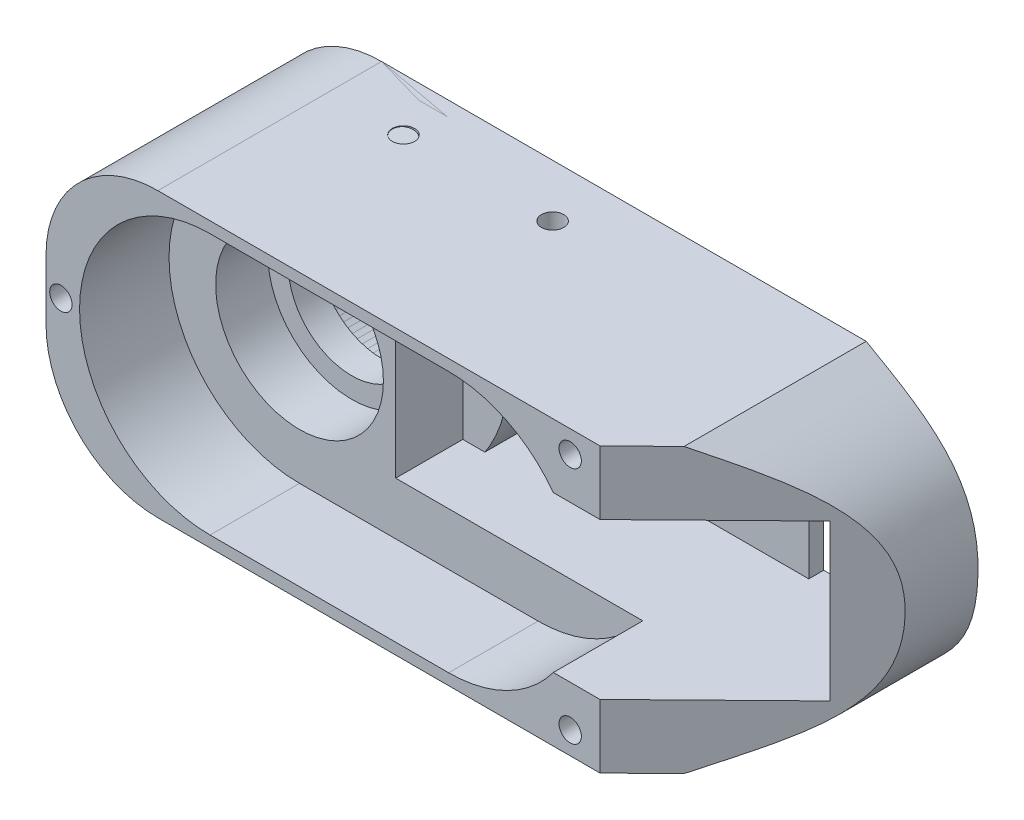
from build123d import *

# Parameters (mm, degrees)
NECKROT_3_0_3_DIAMETER_HOLE1_OUTLINE_W   = 55
NECKROT_3_0_3_DIAMETER_HOLE1_OUTLINE_H   = 20.891455382
NECKROT_3_0_3_DIAMETER_HOLE1_OUTLINE_R   = 11.25
NECKROT_3_0_3_DIAMETER_HOLE1_DEPTH       = 5.559887919
NECKROT_3_0_START                        = 8.559888019
NECKROT_3_0_3_DIAMETER_HOLE1_2_OUTLI_R   = 11.25
NECKROT_3_0_3_DIAMETER_HOLE1_2_DEPTH     = 9.440111981
NECKROT_3_0_3_DIAMETER_HOLE1_3_OUTLI_R   = 11.25
NECKROT_3_0_3_DIAMETER_HOLE1_3_OUTLI_R_2 = 8.5
NECKROT_3_0_3_DIAMETER_HOLE1_3_DEPTH     = 1.440111981
NECKROT_3_0_3_DIAMETER_HOLE1_4_OUTLI_W   = 7.3
NECKROT_3_0_3_DIAMETER_HOLE1_4_OUTLI_H   = 20.891455382
NECKROT_3_0_3_DIAMETER_HOLE1_4_OUTLI_R   = 2.25
NECKROT_3_0_3_DIAMETER_HOLE1_4_OUTLI_W_2 = 6.7
NECKROT_3_0_3_DIAMETER_HOLE1_4_DEPTH     = 2
NECKROT_3_0_START_2                      = 7
NECKROT_3_0_3_DIAMETER_HOLE1_5_OUTLI_R   = 11.25
NECKROT_3_0_3_DIAMETER_HOLE1_5_OUTLI_R_2 = 8.5
NECKROT_3_0_3_DIAMETER_HOLE1_5_DEPTH     = 4
NECKROT_3_0_START_3                      = 2
NECKROT_3_0_3_DIAMETER_HOLE1_6_OUTLI_R   = 1.5
NECKROT_3_0_3_DIAMETER_HOLE1_6_DEPTH     = 7.771146533
NECKROT_3_0_START_4                      = 5.559887919
NECKROT_3_0_3_DIAMETER_HOLE1_7_OUTLI_R   = 1.5
NECKROT_3_0_3_DIAMETER_HOLE1_7_DEPTH     = 24.440112081
NECKROT_3_0_3_DIAMETER_HOLE1_8_OUTLI_R   = 11.25
NECKROT_3_0_3_DIAMETER_HOLE1_8_DEPTH     = 3.0000001
NECKROT_3_0_START_5                      = -20
NECKROT_3_0_3_DIAMETER_HOLE1_9_DEPTH     = 40
NECKROT_3_0_3_DIAMETER_HOLE1_10_OUTL_R   = 1.5
NECKROT_3_0_3_DIAMETER_HOLE1_10_DEPTH    = 7
NECKROT_3_0_START_6                      = 13
NECKROT_3_0_3_DIAMETER_HOLE1_11_OUTL_R   = 1.5
NECKROT_3_0_3_DIAMETER_HOLE1_11_DEPTH    = 7
EXTRUDE1_DEPTH                           = 2
SKETCH4_R                                = 19
EXTRUDE4_DEPTH                           = 9
SKETCH3_R                                = 4
EXTRUDE3_DEPTH                           = 62.326992587
EXTRUDE5_START                           = -7
SKETCH5_R                                = 11.25
EXTRUDE5_DEPTH                           = 7
SKETCH6_W                                = 1.5
SKETCH6_H                                = 20
F_3_0_3_DIAMETER_HOLE1_AT_2_COUNT        = 2
F_3_0_3_DIAMETER_HOLE1_AT_2_PITCH        = 32
EXTRUDE6_START                           = -10
SKETCH7_R                                = 1.5
EXTRUDE6_DEPTH                           = 10
SKETCH8_R                                = 3.5
EXTRUDE7_DEPTH                           = 7


with BuildPart() as part:
    # <neckrot>-<Ø3.0 (3) Diameter Hole1>: read off the stored shape, not the designer's step
    # <neckrot>-<Ø3.0 (3) Diameter Hole1> outline → <neckrot>-<Ø3.0 (3) Diameter Hole1> (new body)
    with BuildSketch(Plane.XY):
        with BuildLine():
            Line((-35, -19), (30, -19))
            add(Edge.make_bspline(
                [(30, -19), (37.933016475, -14.419870803), (44.967612, -11.088320981), (45.16011468, 10.828695002), (36.561245044, 15.211863407), (30, 19)],
                knots=[0, 0, 0, 0, 0.45437066, 0.55437066, 1, 1, 1, 1], degree=3))
            Line((30, 19), (-35, 19))
            ThreePointArc((-35, 19), (-45.606601718, 14.606601718), (-50, 4))
            Line((-50, 4), (-50, -4))
            ThreePointArc((-50, -4), (-45.606601718, -14.606601718), (-35, -19))
        make_face()
        with Locations((12.4, 0)):
            Rectangle(NECKROT_3_0_3_DIAMETER_HOLE1_OUTLINE_W, NECKROT_3_0_3_DIAMETER_HOLE1_OUTLINE_H, mode=Mode.SUBTRACT)
        with Locations((-28, 0)):
            Circle(NECKROT_3_0_3_DIAMETER_HOLE1_OUTLINE_R, mode=Mode.SUBTRACT)
    extrude(amount=NECKROT_3_0_3_DIAMETER_HOLE1_DEPTH)

    # neckrot_-_3.0 _3_ Diameter Hole1 4 outli → neckrot_-_3.0 _3_ Diameter Hole1 4 (add)
    # profile 1 of 2: a face of its own
    with BuildSketch(Plane.XY):
        with Locations((-11.45, 0)):
            Rectangle(NECKROT_3_0_3_DIAMETER_HOLE1_4_OUTLI_W, NECKROT_3_0_3_DIAMETER_HOLE1_4_OUTLI_H)
        with Locations((-11.246799455, -4.995727691)):
            Circle(NECKROT_3_0_3_DIAMETER_HOLE1_4_OUTLI_R, mode=Mode.SUBTRACT)
        with Locations((-11.246799455, 5.004272309)):
            Circle(NECKROT_3_0_3_DIAMETER_HOLE1_4_OUTLI_R, mode=Mode.SUBTRACT)
    # profile 2 of 2: a face of its own
    with BuildSketch(Plane.XY):
        with Locations((36.55, 0)):
            Rectangle(NECKROT_3_0_3_DIAMETER_HOLE1_4_OUTLI_W_2, NECKROT_3_0_3_DIAMETER_HOLE1_4_OUTLI_H)
        with Locations((36.013200545, -4.995727691)):
            Circle(NECKROT_3_0_3_DIAMETER_HOLE1_4_OUTLI_R, mode=Mode.SUBTRACT)
        with Locations((36.013200545, 5.004272309)):
            Circle(NECKROT_3_0_3_DIAMETER_HOLE1_4_OUTLI_R, mode=Mode.SUBTRACT)
    extrude(amount=NECKROT_3_0_3_DIAMETER_HOLE1_4_DEPTH)



with BuildPart() as body_2:
    # neckrot_-_3.0 _3_ Diameter Hole1 2 outli → neckrot_-_3.0 _3_ Diameter Hole1 2 (new body)
    with BuildSketch(Plane.XY.offset(NECKROT_3_0_START)):
        with BuildLine():
            Line((-15.1, 10.445727691), (18.040540339, 10.445727691))
            ThreePointArc((18.040540339, 10.445727691), (11.856518485, 15.637298913), (4, 17.5))
            Line((4, 17.5), (-28, 17.5))
            ThreePointArc((-28, 17.5), (-45.5, 0), (-28, -17.5))
            Line((-28, -17.5), (4, -17.5))
            ThreePointArc((4, -17.5), (11.856518485, -15.637298913), (18.040540339, -10.445727691))
            Line((18.040540339, -10.445727691), (-15.1, -10.445727691))
            Line((-15.1, -10.445727691), (-15.1, 10.445727691))
        make_face()
        with Locations((-28, 0)):
            Circle(NECKROT_3_0_3_DIAMETER_HOLE1_2_OUTLI_R, mode=Mode.SUBTRACT)
    extrude(amount=NECKROT_3_0_3_DIAMETER_HOLE1_2_DEPTH)

    # neckrot_-_3.0 _3_ Diameter Hole1 3 outli → neckrot_-_3.0 _3_ Diameter Hole1 3 (add)
    # profile 1 of 2: a face of its own
    with BuildSketch(Plane.XY.offset(NECKROT_3_0_START)):
        with BuildLine():
            Line((-35, -19), (30, -19))
            add(Edge.make_bspline(
                [(30, -19), (37.933016475, -14.419870803), (44.967612, -11.088320981), (45.16011468, 10.828695002), (36.561245044, 15.211863407), (30, 19)],
                knots=[0, 0, 0, 0, 0.45437066, 0.55437066, 1, 1, 1, 1], degree=3))
            Line((30, 19), (-35, 19))
            ThreePointArc((-35, 19), (-45.606601718, 14.606601718), (-50, 4))
            Line((-50, 4), (-50, -4))
            ThreePointArc((-50, -4), (-45.606601718, -14.606601718), (-35, -19))
        make_face()
        with BuildLine():
            ThreePointArc((4, 17.5), (11.856518485, 15.637298913), (18.040540339, 10.445727691))
            Line((18.040540339, 10.445727691), (39.9, 10.445727691))
            Line((39.9, 10.445727691), (39.9, -10.445727691))
            Line((39.9, -10.445727691), (18.040540339, -10.445727691))
            ThreePointArc((18.040540339, -10.445727691), (11.856518485, -15.637298913), (4, -17.5))
            Line((4, -17.5), (-28, -17.5))
            ThreePointArc((-28, -17.5), (-45.5, 0), (-28, 17.5))
            Line((-28, 17.5), (4, 17.5))
        make_face(mode=Mode.SUBTRACT)
    # profile 2 of 2: a face of its own
    with BuildSketch(Plane.XY.offset(NECKROT_3_0_START)):
        with Locations((-28, 0)):
            Circle(NECKROT_3_0_3_DIAMETER_HOLE1_3_OUTLI_R)
        with Locations((-28, 0)):
            Circle(NECKROT_3_0_3_DIAMETER_HOLE1_3_OUTLI_R_2, mode=Mode.SUBTRACT)
    extrude(amount=NECKROT_3_0_3_DIAMETER_HOLE1_3_DEPTH)

    # neckrot_-_3.0 _3_ Diameter Hole1 5 outli → neckrot_-_3.0 _3_ Diameter Hole1 5 (add)
    with BuildSketch(Plane.XY.offset(NECKROT_3_0_START_2)):
        with Locations((-28, 0)):
            Circle(NECKROT_3_0_3_DIAMETER_HOLE1_5_OUTLI_R)
        with Locations((-28, 0)):
            Circle(NECKROT_3_0_3_DIAMETER_HOLE1_5_OUTLI_R_2, mode=Mode.SUBTRACT)
    extrude(amount=NECKROT_3_0_3_DIAMETER_HOLE1_5_DEPTH)


with BuildPart() as part_1:
    add(part.part)

    add(body_2.part)  # neckrot_-_3.0 _3_ Diameter Hole1 6 merges body 2
    # neckrot_-_3.0 _3_ Diameter Hole1 6 outli → neckrot_-_3.0 _3_ Diameter Hole1 6 (add)
    with BuildSketch(Plane.XY.offset(NECKROT_3_0_START_3)):
        with Locations((20.297369985, 16)):
            Circle(NECKROT_3_0_3_DIAMETER_HOLE1_6_OUTLI_R)
        with Locations((20.297369985, -16)):
            Circle(NECKROT_3_0_3_DIAMETER_HOLE1_6_OUTLI_R)
        with Locations((-48, 0)):
            Circle(NECKROT_3_0_3_DIAMETER_HOLE1_6_OUTLI_R)
    extrude(amount=NECKROT_3_0_3_DIAMETER_HOLE1_6_DEPTH)

    # neckrot_-_3.0 _3_ Diameter Hole1 7 outli → neckrot_-_3.0 _3_ Diameter Hole1 7 (add)
    with BuildSketch(Plane.XY.offset(NECKROT_3_0_START_4)):
        with BuildLine():
            Line((-35, -19), (30, -19))
            add(Edge.make_bspline(
                [(30, -19), (37.933016475, -14.419870803), (44.967612, -11.088320981), (45.16011468, 10.828695002), (36.561245044, 15.211863407), (30, 19)],
                knots=[0, 0, 0, 0, 0.45437066, 0.55437066, 1, 1, 1, 1], degree=3))
            Line((30, 19), (-35, 19))
            ThreePointArc((-35, 19), (-45.606601718, 14.606601718), (-50, 4))
            Line((-50, 4), (-50, -4))
            ThreePointArc((-50, -4), (-45.606601718, -14.606601718), (-35, -19))
        make_face()
        with Locations((20.297369985, -16)):
            Circle(NECKROT_3_0_3_DIAMETER_HOLE1_7_OUTLI_R, mode=Mode.SUBTRACT)
        with Locations((-48, 0)):
            Circle(NECKROT_3_0_3_DIAMETER_HOLE1_7_OUTLI_R, mode=Mode.SUBTRACT)
        with BuildLine():
            ThreePointArc((18.040540339, -10.445727691), (11.856518485, -15.637298913), (4, -17.5))
            Line((4, -17.5), (-28, -17.5))
            ThreePointArc((-28, -17.5), (-45.5, 0), (-28, 17.5))
            Line((-28, 17.5), (4, 17.5))
            ThreePointArc((4, 17.5), (11.856518485, 15.637298913), (18.040540339, 10.445727691))
            Line((18.040540339, 10.445727691), (39.9, 10.445727691))
            Line((39.9, 10.445727691), (39.9, -10.445727691))
            Line((39.9, -10.445727691), (18.040540339, -10.445727691))
        make_face(mode=Mode.SUBTRACT)
        with Locations((20.297369985, 16)):
            Circle(NECKROT_3_0_3_DIAMETER_HOLE1_7_OUTLI_R, mode=Mode.SUBTRACT)
    extrude(amount=NECKROT_3_0_3_DIAMETER_HOLE1_7_DEPTH)

    # neckrot_-_3.0 _3_ Diameter Hole1 8 outli → neckrot_-_3.0 _3_ Diameter Hole1 8 (add)
    with BuildSketch(Plane.XY.offset(NECKROT_3_0_START_4)):
        with BuildLine():
            Line((-28, -17.5), (4, -17.5))
            ThreePointArc((4, -17.5), (11.856518485, -15.637298913), (18.040540339, -10.445727691))
            Line((18.040540339, -10.445727691), (-15.1, -10.445727691))
            Line((-15.1, -10.445727691), (-15.1, 10.445727691))
            Line((-15.1, 10.445727691), (18.040540339, 10.445727691))
            ThreePointArc((18.040540339, 10.445727691), (11.856518485, 15.637298913), (4, 17.5))
            Line((4, 17.5), (-28, 17.5))
            ThreePointArc((-28, 17.5), (-45.5, 0), (-28, -17.5))
        make_face()
        with Locations((-28, 0)):
            Circle(NECKROT_3_0_3_DIAMETER_HOLE1_8_OUTLI_R, mode=Mode.SUBTRACT)
    extrude(amount=NECKROT_3_0_3_DIAMETER_HOLE1_8_DEPTH)

    # neckrot_-_3.0 _3_ Diameter Hole1 9 outli → neckrot_-_3.0 _3_ Diameter Hole1 9 (cut)
    with BuildSketch(Plane(origin=(0, 0, 0), x_dir=(1, 0, 0), z_dir=(0, 1, 0)).offset(NECKROT_3_0_START_5)):
        Polygon((47, -7.816919914), (45.000003408, -9.771146563), (24.297369985, -30), (47, -30), align=None)
    extrude(amount=NECKROT_3_0_3_DIAMETER_HOLE1_9_DEPTH, mode=Mode.SUBTRACT)

    # neckrot_-_3.0 _3_ Diameter Hole1 10 outl → neckrot_-_3.0 _3_ Diameter Hole1 10 (cut)
    with BuildSketch(Plane(origin=(0, 0, 0), x_dir=(1, 0, 0), z_dir=(0, 1, 0)).offset(NECKROT_3_0_START_5)):
        with Locations((-5, -7.059888019)):
            Circle(NECKROT_3_0_3_DIAMETER_HOLE1_10_OUTL_R)
        with Locations((-25, -7.059888019)):
            Circle(NECKROT_3_0_3_DIAMETER_HOLE1_10_OUTL_R)
    extrude(amount=NECKROT_3_0_3_DIAMETER_HOLE1_10_DEPTH, mode=Mode.SUBTRACT)

    # neckrot_-_3.0 _3_ Diameter Hole1 11 outl → neckrot_-_3.0 _3_ Diameter Hole1 11 (cut)
    with BuildSketch(Plane(origin=(0, 0, 0), x_dir=(1, 0, 0), z_dir=(0, 1, 0)).offset(NECKROT_3_0_START_6)):
        with Locations((-5, -7.059888019)):
            Circle(NECKROT_3_0_3_DIAMETER_HOLE1_11_OUTL_R)
        with Locations((-25, -7.059888019)):
            Circle(NECKROT_3_0_3_DIAMETER_HOLE1_11_OUTL_R)
    extrude(amount=NECKROT_3_0_3_DIAMETER_HOLE1_11_DEPTH, mode=Mode.SUBTRACT)


with BuildPart() as body_2_2:
    # Sketch1 → Extrude1 (new body)
    with BuildSketch(Plane.XY):
        with BuildLine():
            Line((-35, -19), (24.297369985, -19))
            Line((24.297369985, -19), (24.297369985, 19))
            Line((24.297369985, 19), (-35, 19))
            ThreePointArc((-35, 19), (-45.606601718, 14.606601718), (-50, 4))
            Line((-50, 4), (-50, -4))
            ThreePointArc((-50, -4), (-45.606601718, -14.606601718), (-35, -19))
        make_face()
    extrude(amount=EXTRUDE1_DEPTH)

    # Sketch4 → Extrude4 (add)
    with BuildSketch(Plane(origin=(0, 0, 0), x_dir=(-1, 0, 0), z_dir=(0, 0, -1))):
        with Locations((28, 0)):
            Circle(SKETCH4_R)
    extrude(amount=-EXTRUDE4_DEPTH)

    # Sketch3 → Extrude3 (cut, through all)
    with BuildSketch(Plane(origin=(0, 0, 0), x_dir=(-1, 0, 0), z_dir=(0, 0, -1))):
        with Locations((28, 0)):
            Circle(SKETCH3_R)
    extrude(amount=-EXTRUDE3_DEPTH, mode=Mode.SUBTRACT)

    # Sketch5 → Extrude5 (cut)
    with BuildSketch(Plane.XY.offset(9).offset(EXTRUDE5_START)):
        with Locations((-28, 0)):
            Circle(SKETCH5_R)
    extrude(amount=EXTRUDE5_DEPTH, mode=Mode.SUBTRACT)

    # Sketch6 → Ø3.0 (3) Diameter Hole1 (revolve, cut)
    with BuildSketch(Plane(origin=(20.297369985, 16, 2), x_dir=(0, -1, 0), z_dir=(1, 0, 0))):
        with Locations((0.75, 10)):
            Rectangle(SKETCH6_W, SKETCH6_H)
    f_3_0_3_diameter_hole1 = revolve(axis=Axis((20.297369985, 16, 8.35), (0, 0, -1)), mode=Mode.SUBTRACT)

    # Ø3.0 (3) Diameter Hole1 at 2: Ø3.0 (3) Diameter Hole1 ×2
    with Locations(*[(0, -i * F_3_0_3_DIAMETER_HOLE1_AT_2_PITCH, 0) for i in range(1, F_3_0_3_DIAMETER_HOLE1_AT_2_COUNT)]):
        add(f_3_0_3_diameter_hole1, mode=Mode.SUBTRACT)

    # Sketch7 → Extrude6 (cut)
    with BuildSketch(Plane.XY.offset(9).offset(EXTRUDE6_START)):
        with Locations((-48, 0)):
            Circle(SKETCH7_R)
    extrude(amount=EXTRUDE6_DEPTH, mode=Mode.SUBTRACT)

    # Sketch8 → Extrude7 (cut)
    with BuildSketch(Plane.XY.offset(9)):
        with Locations((-48, 0)):
            Circle(SKETCH8_R)
    extrude(amount=-EXTRUDE7_DEPTH, mode=Mode.SUBTRACT)


solid = Compound([part_1.part, body_2_2.part])
